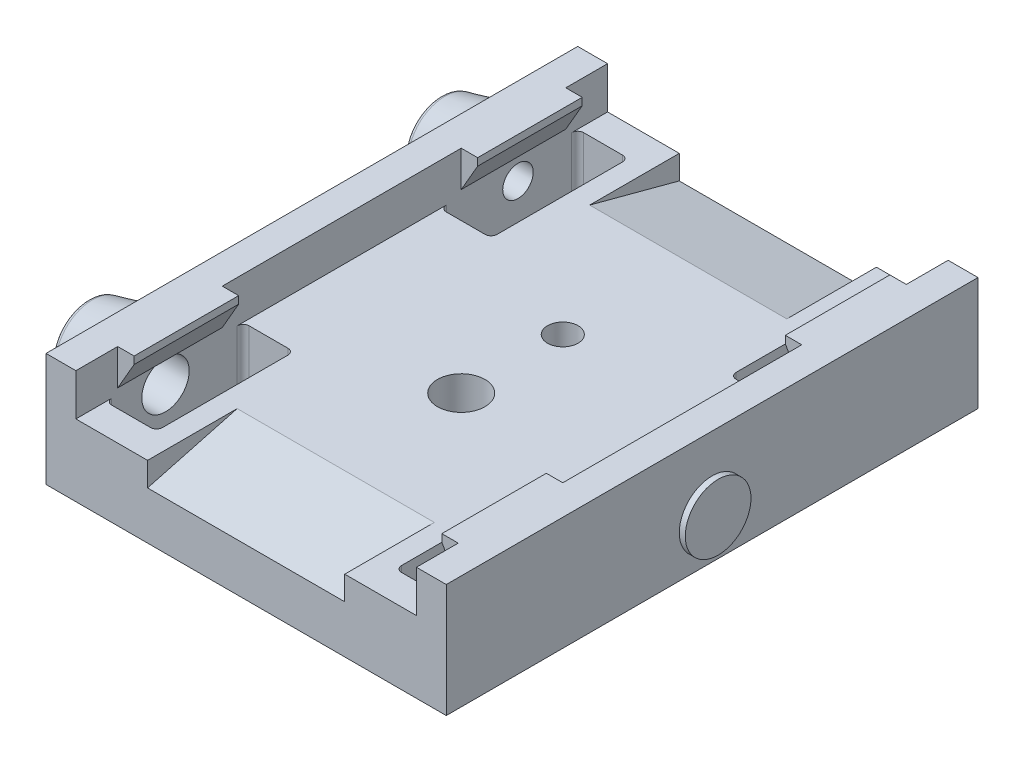
from build123d import *

# Parameters (mm, degrees)
SKETCH_1_W                    = 67
SKETCH_1_H                    = 19
EXTRUDE_1_DEPTH               = 89
CUT_EXTRUDE_1_DEPTH           = 96.56934655
CUT_EXTRUDE_2_REACH           = 98.976
SKETCH_3_W                    = 57
SKETCH_3_H                    = 7
SKETCH_3_H_2                  = 40
SKETCH_4_W                    = 8.5
SKETCH_4_H                    = 23
CUT_EXTRUDE_3_DEPTH           = 12
HOLE_WIZARD_1_4_201_D         = 5.1054
HOLE_WIZARD_3_8_161_D         = 7.9375
HOLE_WIZARD_3_8_161_DEPTH     = 26.99
HOLE_WIZARD_3_8_161_TIP       = 2.384665582
FILLET_1_R                    = 1
HOLE_START                    = -41.5
HOLE_WIZARD_3_8_162_OUTLINE_R = 3.96875
HOLE_WIZARD_3_8_162_DEPTH     = 13
HOLE_WIZARD_1_4_202_REACH     = 118.774
HOLE_WIZARD_1_4_202_BORE_R    = 2.5527
SKETCH_17_R                   = 3.5
EXTRUDE_2_DEPTH               = 7
FILLET_2_R                    = 1
CHAMFER_1_SIZE                = 0.5
CUT_EXTRUDE_4_DEPTH           = 33
SKETCH_19_R                   = 5.5
EXTRUDE_3_DEPTH               = 1


with BuildPart() as part:
    # Эскиз1 → Бобышка-Вытянуть1 (new body)
    with BuildSketch(Plane.XY):
        Rectangle(SKETCH_1_W, SKETCH_1_H)
    extrude(amount=EXTRUDE_1_DEPTH)

    # Эскиз2 → Вырез-Вытянуть1 (cut, through all)
    with BuildSketch(Plane.XY.offset(89)):
        Polygon((-28.5, 2.5), (28.5, 2.5), (28.5, 3.5), (25.75, 8.263139721), (25.75, 9.5), (-25.75, 9.5), (-25.75, 8.263139721), (-28.5, 3.5), align=None)
    extrude(amount=-CUT_EXTRUDE_1_DEPTH, mode=Mode.SUBTRACT)

    # Вырез-Вытянуть2: up to this face of the body (flat: up to its plane)
    cut_extrude_2_end = Plane(part.part.faces().sort_by_distance((0, 2.5, 44.5))[0])
    # Эскиз3 → Вырез-Вытянуть2 (cut, up to the picked face)
    with BuildSketch(Plane(origin=(0, 9.5, 0), x_dir=(1, 0, 0), z_dir=(0, 1, 0)), mode=Mode.PRIVATE) as cut_extrude_2_sk1:
        with Locations((0, -85.5)):
            Rectangle(SKETCH_3_W, SKETCH_3_H)
    cut_extrude_2_tool1 = split(extrude(cut_extrude_2_sk1.sketch, amount=-CUT_EXTRUDE_2_REACH, mode=Mode.PRIVATE), bisect_by=cut_extrude_2_end, keep=Keep.BOTH, mode=Mode.PRIVATE)
    # Эскиз3 → Вырез-Вытянуть2 (cut, up to the picked face)
    with BuildSketch(Plane(origin=(0, 9.5, 0), x_dir=(1, 0, 0), z_dir=(0, 1, 0)), mode=Mode.PRIVATE) as cut_extrude_2_sk2:
        with Locations((0, -44.5)):
            Rectangle(SKETCH_3_W, SKETCH_3_H_2)
    cut_extrude_2_tool2 = split(extrude(cut_extrude_2_sk2.sketch, amount=-CUT_EXTRUDE_2_REACH, mode=Mode.PRIVATE), bisect_by=cut_extrude_2_end, keep=Keep.BOTH, mode=Mode.PRIVATE)
    # Эскиз3 → Вырез-Вытянуть2 (cut, up to the picked face)
    with BuildSketch(Plane(origin=(0, 9.5, 0), x_dir=(1, 0, 0), z_dir=(0, 1, 0)), mode=Mode.PRIVATE) as cut_extrude_2_sk3:
        with Locations((0, -3.5)):
            Rectangle(SKETCH_3_W, SKETCH_3_H)
    cut_extrude_2_tool3 = split(extrude(cut_extrude_2_sk3.sketch, amount=-CUT_EXTRUDE_2_REACH, mode=Mode.PRIVATE), bisect_by=cut_extrude_2_end, keep=Keep.BOTH, mode=Mode.PRIVATE)
    add(cut_extrude_2_tool1.solids().sort_by(Axis((0, 9.5, 85.5), (0, -1, 0)))[0], mode=Mode.SUBTRACT)
    add(cut_extrude_2_tool2.solids().sort_by(Axis((0, 9.5, 44.5), (0, -1, 0)))[0], mode=Mode.SUBTRACT)
    add(cut_extrude_2_tool3.solids().sort_by(Axis((0, 9.5, 3.5), (0, -1, 0)))[0], mode=Mode.SUBTRACT)

    # Эскиз4 → Вырез-Вытянуть3 (cut)
    with BuildSketch(Plane.XZ.offset(9.5)):
        with Locations((-24.25, 72.5)):
            Rectangle(SKETCH_4_W, SKETCH_4_H)
        with Locations((24.25, 72.5)):
            Rectangle(SKETCH_4_W, SKETCH_4_H)
        with Locations((-24.25, 16.5)):
            Rectangle(SKETCH_4_W, SKETCH_4_H)
        with Locations((24.25, 16.5)):
            Rectangle(SKETCH_4_W, SKETCH_4_H)
    extrude(amount=-CUT_EXTRUDE_3_DEPTH, mode=Mode.SUBTRACT)

    # Отверстие обработанное метчиком 1/4-201 (through all)
    with Locations(Plane(origin=(0, -9.5, 0), x_dir=(-1, 0, 0), z_dir=(0, -1, 0))):
        with Locations((0, -36)):
            Hole(HOLE_WIZARD_1_4_201_D / 2)

    # Отверстие обработанное метчиком 3/8-161
    with Locations(Plane(origin=(0, -9.5, 0), x_dir=(-1, 0, 0), z_dir=(0, -1, 0))):
        with Locations((0, -53)):
            Hole(HOLE_WIZARD_3_8_161_D / 2, depth=HOLE_WIZARD_3_8_161_DEPTH)
            with Locations((0, 0, -(HOLE_WIZARD_3_8_161_DEPTH + HOLE_WIZARD_3_8_161_TIP / 2))):  # 118° drill point
                Cone(0, HOLE_WIZARD_3_8_161_D / 2, HOLE_WIZARD_3_8_161_TIP, mode=Mode.SUBTRACT)

    # Скругление1
    fillet_1_edges = [part.edges().sort_by_distance(p)[0] for p in [
        (-20, -3.5, 84),
        (-20, -3.5, 61),
        (-28.5, -3.5, 61),
        (-28.5, -3.5, 84),
        (20, -3.5, 84),
        (28.5, -3.5, 84),
        (28.5, -3.5, 61),
        (20, -3.5, 61),
        (-28.5, -3.5, 5),
        (-28.5, -3.5, 28),
        (-20, -3.5, 28),
        (-20, -3.5, 5),
        (28.5, -3.5, 28),
        (28.5, -3.5, 5),
        (20, -3.5, 5),
        (20, -3.5, 28),
    ]]
    fillet(fillet_1_edges, radius=FILLET_1_R)

    # По сечениям1: read off the stored shape, not the designer's step
    # По сечениям1: loft between two sections, ruled curve by curve
    loft_1_from = [
        Edge.make_bspline([(-33.5, 5.960828972, 20.335589749), (-33.5, 16.63200847, 8.413931805), (-33.5, 4.710350526, -2.257247693), (-33.5, -5.960828972, 9.664410251), (-33.5, -16.63200847, 21.586068195), (-33.5, -4.710350526, 32.257247693), (-33.5, 5.960828972, 20.335589749)], [0, 0, 0, 0, 0.5, 0.5, 0.5, 1, 1, 1, 1], 3, [1, 0.333333333, 0.333333333, 1, 0.333333333, 0.333333333, 1]),
    ]
    loft_1_to = [
        Edge.make_bspline([(-41.5, 5.342611917, 17.730658877), (-41.5, 10.803929671, 7.045435042), (-41.5, 0.118705836, 1.584117289), (-41.5, -5.342611917, 12.269341123), (-41.5, -10.803929671, 22.954564958), (-41.5, -0.118705836, 28.415882711), (-41.5, 5.342611917, 17.730658877)], [0, 0, 0, 0, 0.5, 0.5, 0.5, 1, 1, 1, 1], 3, [1, 0.333333333, 0.333333333, 1, 0.333333333, 0.333333333, 1]),
    ]
    loft_1 = Solid(Shell([*[Face.make_surface_from_curves(loft_1_from[k], loft_1_to[k]) for k in range(1)], Face(Wire(loft_1_from)), Face(Wire(loft_1_to))]))
    add(loft_1)

    # Зеркальное отражение1: По сечениям1 across plane
    add(loft_1.mirror(Plane.XY.offset(44.5)))

    # Отверстие обработанное метчиком 3/8-162: read off the stored shape, not the designer's step
    # Отверстие обработанное метчиком 3/8-162 outline → Отверстие обработанное метчиком 3/8-162 (cut)
    with BuildSketch(Plane.YZ.offset(HOLE_START)):
        with Locations((0, 74)):
            Circle(HOLE_WIZARD_3_8_162_OUTLINE_R)
    extrude(amount=HOLE_WIZARD_3_8_162_DEPTH, mode=Mode.SUBTRACT)

    # Отверстие обработанное метчиком 1/4-202 bore → Отверстие обработанное метчиком 1/4-202 (cut, up to next)
    with BuildSketch(Plane.ZY.offset(41.5), mode=Mode.PRIVATE) as hole_wizard_1_4_202_sk1:
        with Locations((15, 0)):
            Circle(HOLE_WIZARD_1_4_202_BORE_R)
    hole_wizard_1_4_202_tool1 = extrude(hole_wizard_1_4_202_sk1.sketch, amount=-HOLE_WIZARD_1_4_202_REACH, mode=Mode.PRIVATE) & part.part
    add(hole_wizard_1_4_202_tool1.solids().sort_by_distance((-41.5, 0, 15))[0], mode=Mode.SUBTRACT)

    # Эскиз17 → Бобышка-Вытянуть2 (add)
    with BuildSketch(Plane.ZY.offset(33.5)):
        with Locations(Location((44.5, -2.5, 0), (0, 0, 180))):
            Circle(SKETCH_17_R)
    extrude(amount=EXTRUDE_2_DEPTH)

    # Скругление2
    fillet_2_edges = [part.edges().sort_by_distance(p)[0] for p in [
        (-41.5, -5.342611917, 12.269341123),
        (-33.5, -5.960828972, 9.664410251),
        (-33.5, -5.960828972, 79.335589749),
        (-41.5, -5.342611917, 76.730658877),
    ]]
    fillet(fillet_2_edges, radius=FILLET_2_R)

    # Фаска1
    chamfer_1_edges = [part.edges().sort_by_distance(p)[0] for p in [
        (-40.5, -2.5, 48),
    ]]
    chamfer(chamfer_1_edges, length=CHAMFER_1_SIZE)

    # Эскиз18 → Вырез-Вытянуть4 (cut)
    with BuildSketch(Plane(origin=(16.5, 0, 0), x_dir=(0, 0, -1), z_dir=(1, 0, 0))):
        Polygon((-89, -1.5), (-89, 2.5), (-74, 2.5), align=None)
    cut_extrude_4 = extrude(amount=-CUT_EXTRUDE_4_DEPTH, mode=Mode.SUBTRACT)

    # Зеркальное отражение2: Вырез-Вытянуть4 across plane
    add(cut_extrude_4.mirror(Plane.XY.offset(44.5)), mode=Mode.SUBTRACT)

    # Эскиз19 → Бобышка-Вытянуть3 (add)
    with BuildSketch(Plane(origin=(33.5, 0, 0), x_dir=(0, 0, -1), z_dir=(1, 0, 0))):
        with Locations(Location((-44.5, -2.5, 0), (0, 0, 180))):
            Circle(SKETCH_19_R)
    extrude(amount=EXTRUDE_3_DEPTH)


solid = part.part
